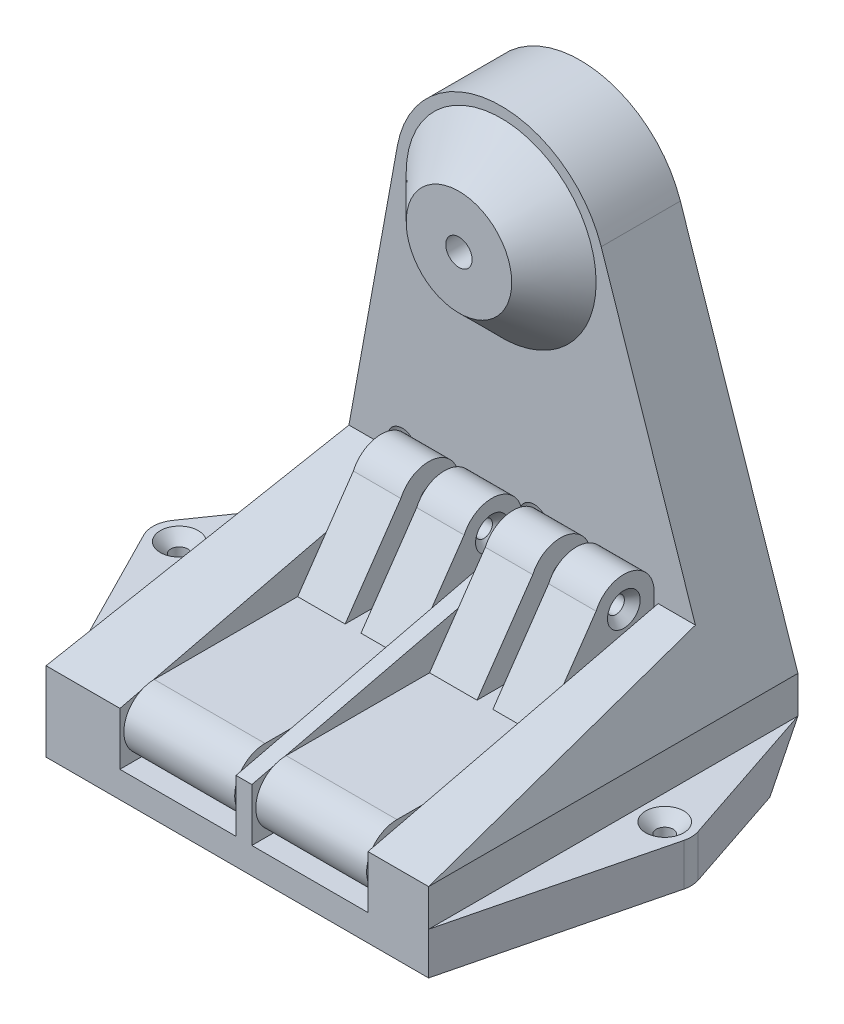
from build123d import *

# Parameters (mm, degrees)
SKETCH2_R               = 2.75
SKETCH2_R_2             = 2.5
BOSS_EXTRUDE1_DEPTH     = 15
SKETCH8_W               = 72.5
SKETCH8_H               = 15
BOSS_EXTRUDE4_DEPTH     = 55
SKETCH9_W               = 22
SKETCH9_H               = 10
CUT_EXTRUDE3_DEPTH      = 55
CUT_EXTRUDE4_START      = -72.5
SKETCH10_R              = 2.15
SKETCH10_R_2            = 2.2
CUT_EXTRUDE4_DEPTH      = 70.5
BOSS_EXTRUDE5_START     = 0.5
SKETCH11_R              = 1.6
SKETCH11_R_2            = 2.15
SKETCH11_R_3            = 2.25
BOSS_EXTRUDE5_DEPTH     = 21
CUT_EXTRUDE5_DEPTH      = 89.301330681
CUT_EXTRUDE5_DEPTH_BACK = 89.301330681
SKETCH12_W              = 3
SKETCH12_H              = 20.831984068
CHAMFER1_START          = -16.75
CHAMFER1_DEPTH          = 9
CHAMFER1_START_2        = -4.75
CHAMFER1_2_DEPTH        = 9
CHAMFER5_SIZE           = 1.5
CUT_EXTRUDE6_DEPTH      = 3
CHAMFER2_SIZE           = 13.2
CHAMFER2_SIZE_2         = 54.981956965
SKETCH13_R              = 1.6
BOSS_EXTRUDE6_DEPTH     = 8
SKETCH14_R              = 10
SKETCH14_R_2            = 2.5
BOSS_EXTRUDE7_DEPTH     = 8
CHAMFER3_SIZE           = 8
CHAMFER4_SIZE           = 8
CHAMFER6_SIZE           = 2
CHAMFER7_SIZE           = 5


with BuildPart() as part:
    # Sketch2 → Boss-Extrude1 (new body)
    with BuildSketch(Plane.XY):
        with BuildLine():
            Line((-31.25, -30), (41.25, -30))
            Line((41.25, -30), (41.25, -15))
            Line((41.25, -15), (18.959201516, 51.367784376))
            ThreePointArc((18.959201516, 51.367784376), (-1.438537689, 64.948198147), (-19.676688722, 48.581608709))
            Line((-19.676688722, 48.581608709), (-31.25, -15))
            Line((-31.25, -15), (-31.25, -30))
        make_face()
        with Locations((-18.75, 0)):
            Circle(SKETCH2_R, mode=Mode.SUBTRACT)
        with Locations((6.25, 0)):
            Circle(SKETCH2_R, mode=Mode.SUBTRACT)
        with Locations((0, 45)):
            Circle(SKETCH2_R_2, mode=Mode.SUBTRACT)
    extrude(amount=BOSS_EXTRUDE1_DEPTH)

    # Sketch8 → Boss-Extrude4 (add)
    with BuildSketch(Plane.XY.offset(15)):
        with Locations((5, -22.5)):
            Rectangle(SKETCH8_W, SKETCH8_H)
    extrude(amount=BOSS_EXTRUDE4_DEPTH)

    # Sketch9 → Cut-Extrude3 (cut)
    with BuildSketch(Plane.XY.offset(70)):
        with Locations((-6.25, -20)):
            Rectangle(SKETCH9_W, SKETCH9_H)
        with Locations((18.75, -20)):
            Rectangle(SKETCH9_W, SKETCH9_H)
    extrude(amount=-CUT_EXTRUDE3_DEPTH, mode=Mode.SUBTRACT)

    # Sketch10 → Cut-Extrude4 (cut)
    with BuildSketch(Plane(origin=(41.25, 0, 0), x_dir=(0, 0, -1), z_dir=(1, 0, 0)).offset(CUT_EXTRUDE4_START)):
        with Locations(Location((-64, -18.75, 0), (0, 0, 180))):
            Circle(SKETCH10_R)
        with Locations(Location((-21, -18.75, 0), (0, 0, 180))):
            Circle(SKETCH10_R_2)
    extrude(amount=CUT_EXTRUDE4_DEPTH, mode=Mode.SUBTRACT)

    # Chamfer2
    # the kernel refuses this chamfer: 54.981956965, 13.2 mm, written as the material it adds along each edge
    with BuildSketch(Plane(origin=(41.25, -15, 15), x_dir=(0, 1, 0), z_dir=(-1, 0, 0))) as chamfer2_piece_1_section:
        Polygon((CHAMFER2_SIZE, 0), (0, -CHAMFER2_SIZE_2), (0, 0), align=None)
    chamfer2_piece_1 = extrude(amount=11.5, mode=Mode.PRIVATE)
    chamfer2_piece_1 = split(chamfer2_piece_1, bisect_by=Plane(origin=(41.25, -15, 15), z_dir=(-0.9479600758233321, -0.31838921879520754, 0)), keep=Keep.TOP, mode=Mode.PRIVATE)
    add(chamfer2_piece_1)
    with BuildSketch(Plane(origin=(41.25, -15, 15), x_dir=(0, 1, 0), z_dir=(-1, 0, 0))) as chamfer2_piece_2_section:
        Polygon((CHAMFER2_SIZE, 0), (0, -CHAMFER2_SIZE_2), (0, 0), align=None)
    chamfer2_piece_2 = extrude(amount=154.306940725, mode=Mode.PRIVATE)
    chamfer2_piece_2 = chamfer2_piece_2 - Plane(origin=(6.25, 0, 15), x_dir=(1, 0, 0), z_dir=(0, 0, -1)) * Cylinder(2.75, 529, mode=Mode.PRIVATE)
    chamfer2_piece_2 = split(chamfer2_piece_2, bisect_by=Plane(origin=(4.75, -15, 15), z_dir=(1, 0, 0)), keep=Keep.TOP, mode=Mode.PRIVATE)
    chamfer2_piece_2 = split(chamfer2_piece_2, bisect_by=Plane(origin=(7.75, -15, 15), z_dir=(-1, 0, 0)), keep=Keep.TOP, mode=Mode.PRIVATE)
    add(chamfer2_piece_2)
    with BuildSketch(Plane(origin=(41.25, -15, 15), x_dir=(0, 1, 0), z_dir=(-1, 0, 0))) as chamfer2_piece_3_section:
        Polygon((CHAMFER2_SIZE, 0), (0, -CHAMFER2_SIZE_2), (0, 0), align=None)
    chamfer2_piece_3 = extrude(amount=154.306940725, mode=Mode.PRIVATE)
    chamfer2_piece_3 = split(chamfer2_piece_3, bisect_by=Plane(origin=(-28.924939328, -2.226551305, 15), z_dir=(0.9838344360889139, -0.1790804354629758, 0)), keep=Keep.TOP, mode=Mode.PRIVATE)
    chamfer2_piece_3 = split(chamfer2_piece_3, bisect_by=Plane(origin=(-31.25, -15, 15), z_dir=(1, 0, 0)), keep=Keep.TOP, mode=Mode.PRIVATE)
    chamfer2_piece_3 = chamfer2_piece_3 - Plane(origin=(-18.75, 0, 15), x_dir=(1, 0, 0), z_dir=(0, 0, -1)) * Cylinder(2.75, 529, mode=Mode.PRIVATE)
    chamfer2_piece_3 = split(chamfer2_piece_3, bisect_by=Plane(origin=(-17.25, -15, 15), z_dir=(-1, 0, 0)), keep=Keep.TOP, mode=Mode.PRIVATE)
    add(chamfer2_piece_3)
    with BuildSketch(Plane(origin=(150.556940725, -15, 15), x_dir=(0, 1, 0), z_dir=(-1, 0, 0))) as chamfer2_piece_4_section:
        Polygon((CHAMFER2_SIZE, 0), (0, -CHAMFER2_SIZE_2), (0, 0), align=None)
    chamfer2_piece_4 = extrude(amount=145.806940725, mode=Mode.PRIVATE)
    chamfer2_piece_4 = split(chamfer2_piece_4, bisect_by=Plane(origin=(52.330629818, -47.991050143, 15), z_dir=(-0.9479600758233321, -0.31838921879520754, 0)), keep=Keep.TOP, mode=Mode.PRIVATE)
    chamfer2_piece_4 = split(chamfer2_piece_4, bisect_by=Plane(origin=(41.25, -15, 15), z_dir=(-1, 0, 0)), keep=Keep.TOP, mode=Mode.PRIVATE)
    chamfer2_piece_4 = split(chamfer2_piece_4, bisect_by=Plane(origin=(29.75, -15, 15), z_dir=(1, 0, 0)), keep=Keep.TOP, mode=Mode.PRIVATE)
    add(chamfer2_piece_4)
    with BuildSketch(Plane(origin=(7.75, -15, 15), x_dir=(0, 1, 0), z_dir=(-1, 0, 0))) as chamfer2_piece_5_section:
        Polygon((CHAMFER2_SIZE, 0), (0, -CHAMFER2_SIZE_2), (0, 0), align=None)
    chamfer2_piece_5 = extrude(amount=3, mode=Mode.PRIVATE)
    chamfer2_piece_5 = chamfer2_piece_5 - Plane(origin=(6.25, 0, 15), x_dir=(1, 0, 0), z_dir=(0, 0, -1)) * Cylinder(2.75, 226, mode=Mode.PRIVATE)
    add(chamfer2_piece_5)
    with BuildSketch(Plane(origin=(7.75, -15, 15), x_dir=(0, 1, 0), z_dir=(-1, 0, 0))) as chamfer2_piece_6_section:
        Polygon((CHAMFER2_SIZE, 0), (0, -CHAMFER2_SIZE_2), (0, 0), align=None)
    chamfer2_piece_6 = extrude(amount=145.806940725, mode=Mode.PRIVATE)
    chamfer2_piece_6 = split(chamfer2_piece_6, bisect_by=Plane(origin=(-29.999277708, -8.12876553, 15), z_dir=(0.9838344360889139, -0.1790804354629758, 0)), keep=Keep.TOP, mode=Mode.PRIVATE)
    chamfer2_piece_6 = split(chamfer2_piece_6, bisect_by=Plane(origin=(-31.25, -15, 15), z_dir=(1, 0, 0)), keep=Keep.TOP, mode=Mode.PRIVATE)
    chamfer2_piece_6 = chamfer2_piece_6 - Plane(origin=(-18.75, 0, 15), x_dir=(1, 0, 0), z_dir=(0, 0, -1)) * Cylinder(2.75, 512, mode=Mode.PRIVATE)
    chamfer2_piece_6 = split(chamfer2_piece_6, bisect_by=Plane(origin=(-17.25, -15, 15), z_dir=(-1, 0, 0)), keep=Keep.TOP, mode=Mode.PRIVATE)
    add(chamfer2_piece_6)
    with BuildSketch(Plane(origin=(125.556940725, -15, 15), x_dir=(0, 1, 0), z_dir=(-1, 0, 0))) as chamfer2_piece_7_section:
        Polygon((CHAMFER2_SIZE, 0), (0, -CHAMFER2_SIZE_2), (0, 0), align=None)
    chamfer2_piece_7 = extrude(amount=156.806940725, mode=Mode.PRIVATE)
    chamfer2_piece_7 = split(chamfer2_piece_7, bisect_by=Plane(origin=(49.796337452, -40.445543443, 15), z_dir=(-0.9479600758233321, -0.31838921879520754, 0)), keep=Keep.TOP, mode=Mode.PRIVATE)
    chamfer2_piece_7 = split(chamfer2_piece_7, bisect_by=Plane(origin=(41.25, -15, 15), z_dir=(-1, 0, 0)), keep=Keep.TOP, mode=Mode.PRIVATE)
    chamfer2_piece_7 = split(chamfer2_piece_7, bisect_by=Plane(origin=(29.75, -15, 15), z_dir=(1, 0, 0)), keep=Keep.TOP, mode=Mode.PRIVATE)
    add(chamfer2_piece_7)
    with BuildSketch(Plane(origin=(125.556940725, -15, 15), x_dir=(0, 1, 0), z_dir=(-1, 0, 0))) as chamfer2_piece_8_section:
        Polygon((CHAMFER2_SIZE, 0), (0, -CHAMFER2_SIZE_2), (0, 0), align=None)
    chamfer2_piece_8 = extrude(amount=156.806940725, mode=Mode.PRIVATE)
    chamfer2_piece_8 = chamfer2_piece_8 - Plane(origin=(6.25, 0, 15), x_dir=(1, 0, 0), z_dir=(0, 0, -1)) * Cylinder(2.75, 534, mode=Mode.PRIVATE)
    chamfer2_piece_8 = split(chamfer2_piece_8, bisect_by=Plane(origin=(4.75, -15, 15), z_dir=(1, 0, 0)), keep=Keep.TOP, mode=Mode.PRIVATE)
    chamfer2_piece_8 = split(chamfer2_piece_8, bisect_by=Plane(origin=(7.75, -15, 15), z_dir=(-1, 0, 0)), keep=Keep.TOP, mode=Mode.PRIVATE)
    add(chamfer2_piece_8)
    with BuildSketch(Plane(origin=(-17.25, -15, 15), x_dir=(0, 1, 0), z_dir=(-1, 0, 0))) as chamfer2_piece_9_section:
        Polygon((CHAMFER2_SIZE, 0), (0, -CHAMFER2_SIZE_2), (0, 0), align=None)
    chamfer2_piece_9 = extrude(amount=14, mode=Mode.PRIVATE)
    chamfer2_piece_9 = split(chamfer2_piece_9, bisect_by=Plane(origin=(-30.801022767, -12.533403011, 15), z_dir=(0.9838344360889139, -0.1790804354629758, 0)), keep=Keep.TOP, mode=Mode.PRIVATE)
    chamfer2_piece_9 = chamfer2_piece_9 - Plane(origin=(-18.75, 0, 15), x_dir=(1, 0, 0), z_dir=(0, 0, -1)) * Cylinder(2.75, 248, mode=Mode.PRIVATE)
    add(chamfer2_piece_9)

    # Sketch13 → Boss-Extrude6 (add)
    # profile 1 of 2: a face of its own
    with BuildSketch(Plane.XZ.offset(30)):
        with BuildLine():
            Line((41.25, 70), (41.25, 0))
            Line((41.25, 0), (50.742391023, 28.415788088))
            ThreePointArc((50.742391023, 28.415788088), (50.996025174, 29.800669968), (50.853528864, 31.201356553))
            Line((50.853528864, 31.201356553), (41.25, 70))
        make_face()
        with Locations(Location((46, 30, 0), (0, 0, 270))):
            Circle(SKETCH13_R, mode=Mode.SUBTRACT)
    # profile 2 of 2: a face of its own
    with BuildSketch(Plane.XZ.offset(30)):
        with BuildLine():
            Line((-31.25, 70), (-31.25, 0))
            Line((-31.25, 0), (-50.106562255, 27.147606891))
            ThreePointArc((-50.106562255, 27.147606891), (-50.988400656, 29.659619478), (-50.455958391, 32.268134657))
            Line((-50.455958391, 32.268134657), (-31.25, 70))
        make_face()
        with Locations(Location((-46, 30, 0), (0, 0, 270))):
            Circle(SKETCH13_R, mode=Mode.SUBTRACT)
    extrude(amount=-BOSS_EXTRUDE6_DEPTH)

    # Sketch14 → Boss-Extrude7 (add)
    with BuildSketch(Plane.XY.offset(15)):
        with Locations((0, 45)):
            Circle(SKETCH14_R)
        with Locations((0, 45)):
            Circle(SKETCH14_R_2, mode=Mode.SUBTRACT)
    extrude(amount=BOSS_EXTRUDE7_DEPTH)

    # Chamfer3
    chamfer3_edges = [part.edges().sort_by_distance(p)[0] for p in [
        (-10, 45, 15),
    ]]
    chamfer(chamfer3_edges, length=CHAMFER3_SIZE - 0.0001)  # a hair under: the kernel refuses the full size

    # Chamfer4
    chamfer4_edges = [part.edges().sort_by_distance(p)[0] for p in [
        (5, -30, 0),
    ]]
    chamfer(chamfer4_edges, length=CHAMFER4_SIZE)

    # Chamfer6
    chamfer6_edges = [part.edges().sort_by_distance(p)[0] for p in [
        (46, -22, 31.6),
        (-46, -22, 31.6),
    ]]
    chamfer(chamfer6_edges, length=CHAMFER6_SIZE)

    # Chamfer7
    chamfer7_edges = [part.edges().sort_by_distance(p)[0] for p in [
        (-21.5, 0, 0),
        (3.5, 0, 0),
        (-2.5, 45, 0),
    ]]
    chamfer(chamfer7_edges, length=CHAMFER7_SIZE)


with BuildPart() as body_2:
    # Sketch11 → Boss-Extrude5 (new body)
    with BuildSketch(Plane(origin=(-17.25, 0, 0), x_dir=(0, 0, -1), z_dir=(1, 0, 0)).offset(BOSS_EXTRUDE5_START)):
        with BuildLine():
            Line((-64, -13), (-26.75, -13))
            Line((-26.75, -13), (-26.75, 0))
            ThreePointArc((-26.75, 0), (-21, 5.75), (-15.25, 0))
            Line((-15.25, 0), (-15.25, -18.75))
            ThreePointArc((-15.25, -18.75), (-16.934136008, -22.815863992), (-21, -24.5))
            Line((-21, -24.5), (-64, -24.5))
            ThreePointArc((-64, -24.5), (-69.75, -18.75), (-64, -13))
        make_face()
        with Locations((-21, 0)):
            Circle(SKETCH11_R, mode=Mode.SUBTRACT)
        with Locations((-64, -18.75)):
            Circle(SKETCH11_R_2, mode=Mode.SUBTRACT)
        with Locations((-21, -18.75)):
            Circle(SKETCH11_R_3, mode=Mode.SUBTRACT)
    extrude(amount=BOSS_EXTRUDE5_DEPTH)

    # Sketch12 → Cut-Extrude5 (cut, two sides: drawn at the far end of the back side and taken through both)
    with BuildSketch(Plane.XY.offset(26.75).offset(-CUT_EXTRUDE5_DEPTH_BACK)):
        with Locations((-6.25, -2.584007966)):
            Rectangle(SKETCH12_W, SKETCH12_H)
    extrude(amount=CUT_EXTRUDE5_DEPTH + CUT_EXTRUDE5_DEPTH_BACK, mode=Mode.SUBTRACT)

    # Chamfer1: read off the stored shape, not the designer's step
    # Chamfer1 outline → Chamfer1 (add)
    with BuildSketch(Plane.YZ.offset(CHAMFER1_START)):
        with BuildLine():
            Line((2.326992396, 26.258099123), (-13, 36.817281538))
            Line((-13, 36.817281538), (-13, 26.75))
            Line((-13, 26.75), (0, 26.75))
            ThreePointArc((0, 26.75), (1.189207728, 26.625680846), (2.326992396, 26.258099123))
        make_face()
    extrude(amount=CHAMFER1_DEPTH)

    # Chamfer1 2 outline → Chamfer1 2 (add)
    with BuildSketch(Plane.YZ.offset(CHAMFER1_START_2)):
        with BuildLine():
            Line((2.326992396, 26.258099123), (-13, 36.817281538))
            Line((-13, 36.817281538), (-13, 26.75))
            Line((-13, 26.75), (0, 26.75))
            ThreePointArc((0, 26.75), (1.189207728, 26.625680846), (2.326992396, 26.258099123))
        make_face()
    extrude(amount=CHAMFER1_2_DEPTH)

    # Chamfer5
    chamfer5_edges = [body_2.edges().sort_by_distance(p)[0] for p in [
        (4.25, 0, 22.6),
    ]]
    chamfer(chamfer5_edges, length=CHAMFER5_SIZE)

    # Sketch15 → Cut-Extrude6 (cut)
    with BuildSketch(Plane.ZY.offset(16.75)):
        Polygon((19.110177635, -2.182178902), (21.944911183, -2.727723628), (23.834733548, -0.545544726), (22.889822365, 2.182178902), (20.055088817, 2.727723628), (18.165266452, 0.545544726), align=None)
    extrude(amount=-CUT_EXTRUDE6_DEPTH, mode=Mode.SUBTRACT)


with BuildPart() as body_3:
    # Body-Move/Copy1: copy of body 2
    add(body_2.part.moved(Location((25, 0, 0))))


solid = Compound([part.part, body_2.part, body_3.part])
